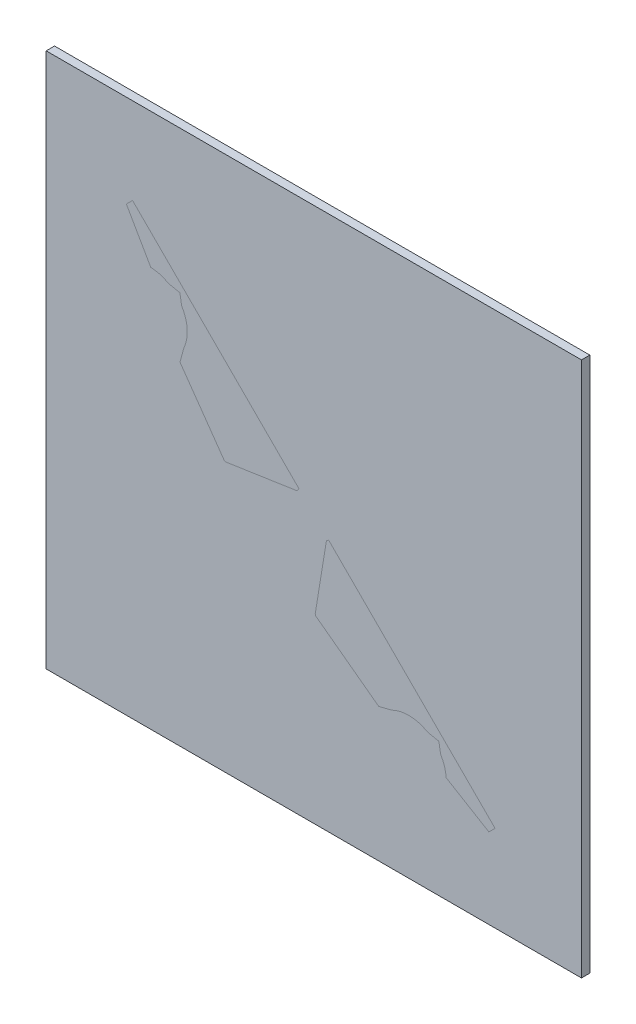
from build123d import *
from build123d.topology import SkipClean

# Parameters (mm, degrees)
BOSS_EXTRUDE1_OUTLINE_R   = 584.2
BOSS_EXTRUDE1_OUTLINE_R_2 = 2.38125
BOSS_EXTRUDE1_OUTLINE_R_3 = 85.725
BOSS_EXTRUDE1_OUTLINE_R_4 = 3.8735
BOSS_EXTRUDE1_OUTLINE_R_5 = 47.5
BOSS_EXTRUDE1_DEPTH       = 19.05
CUT_EXTRUDE1_OUTLINE_W    = 98.758926402
CUT_EXTRUDE1_OUTLINE_H    = 205.000109937
CUT_EXTRUDE1_OUTLINE_R    = 3.8735
CUT_EXTRUDE1_OUTLINE_W_2  = 41.254229691
CUT_EXTRUDE1_OUTLINE_H_2  = 54.392174278
CUT_EXTRUDE1_DEPTH        = 3.175
BOSS_EXTRUDE3_START       = 3.175
SKETCH5_R                 = 60
SKETCH5_R_2               = 47.5
BOSS_EXTRUDE3_DEPTH       = 3.175
CUT_EXTRUDE6_START        = -19.05
CUT_EXTRUDE6_OUTLINE_R    = 2.38125
CUT_EXTRUDE6_DEPTH        = 19.05
SKETCH12_W                = 1219.2
SKETCH12_H                = 1219.2
STOCK_DEPTH               = 19.05
SKETCH14_R                = 3.8735
CUT_EXTRUDE7_DEPTH        = 19.05
SKETCH16_R                = 9.652
CUT_EXTRUDE12_DEPTH       = 9.525
SKETCH17_R                = 7.1755
CUT_EXTRUDE13_DEPTH       = 6.35
SKETCH20_R                = 7.1755
CUT_EXTRUDE16_DEPTH       = 2.54


# Read off the part's stored shape, not the designer's step: Boss-Extrude1, Cut-Extrude1, Cut-Extrude6
with BuildPart() as part:
    # Boss-Extrude1 outline → Boss-Extrude1 (new body)
    with BuildSketch(Plane.XY):
        Circle(BOSS_EXTRUDE1_OUTLINE_R)
        with Locations((-282.898367517, -440.948136872)):
            Circle(BOSS_EXTRUDE1_OUTLINE_R_2, mode=Mode.SUBTRACT)
        with Locations((-148.901632483, -440.948136872)):
            Circle(BOSS_EXTRUDE1_OUTLINE_R_2, mode=Mode.SUBTRACT)
        with Locations((-66.998367517, -498.798367517)):
            Circle(BOSS_EXTRUDE1_OUTLINE_R_2, mode=Mode.SUBTRACT)
        with Locations((-215.9, -373.949769354)):
            Circle(BOSS_EXTRUDE1_OUTLINE_R_3, mode=Mode.SUBTRACT)
        with Locations((-282.898367517, -306.951401837)):
            Circle(BOSS_EXTRUDE1_OUTLINE_R_2, mode=Mode.SUBTRACT)
        with Locations((-148.901632483, -306.951401837)):
            Circle(BOSS_EXTRUDE1_OUTLINE_R_2, mode=Mode.SUBTRACT)
        with Locations((-66.998367517, -364.801632483)):
            Circle(BOSS_EXTRUDE1_OUTLINE_R_2, mode=Mode.SUBTRACT)
        with Locations((-440.948136872, -282.898367517)):
            Circle(BOSS_EXTRUDE1_OUTLINE_R_2, mode=Mode.SUBTRACT)
        with Locations((-526.121546674, -206.375)):
            Circle(BOSS_EXTRUDE1_OUTLINE_R_4, mode=Mode.SUBTRACT)
        with Locations((-533.201525575, -187.325)):
            Circle(BOSS_EXTRUDE1_OUTLINE_R_4, mode=Mode.SUBTRACT)
        with Locations((-440.948136872, -148.901632483)):
            Circle(BOSS_EXTRUDE1_OUTLINE_R_2, mode=Mode.SUBTRACT)
        with Locations((-306.951401837, -282.898367517)):
            Circle(BOSS_EXTRUDE1_OUTLINE_R_2, mode=Mode.SUBTRACT)
        with Locations((-373.949769354, -215.9)):
            Circle(BOSS_EXTRUDE1_OUTLINE_R_3, mode=Mode.SUBTRACT)
        with Locations((-306.951401837, -148.901632483)):
            Circle(BOSS_EXTRUDE1_OUTLINE_R_2, mode=Mode.SUBTRACT)
        with Locations((-565.069727445, -9.525)):
            Circle(BOSS_EXTRUDE1_OUTLINE_R_4, mode=Mode.SUBTRACT)
        with Locations((-498.798367517, -66.998367517)):
            Circle(BOSS_EXTRUDE1_OUTLINE_R_2, mode=Mode.SUBTRACT)
        with Locations((-364.801632483, -66.998367517)):
            Circle(BOSS_EXTRUDE1_OUTLINE_R_2, mode=Mode.SUBTRACT)
        with Locations((66.998367517, -498.798367517)):
            Circle(BOSS_EXTRUDE1_OUTLINE_R_2, mode=Mode.SUBTRACT)
        with Locations((148.901632483, -440.948136872)):
            Circle(BOSS_EXTRUDE1_OUTLINE_R_2, mode=Mode.SUBTRACT)
        with Locations((282.898367517, -440.948136872)):
            Circle(BOSS_EXTRUDE1_OUTLINE_R_2, mode=Mode.SUBTRACT)
        with Locations((0, -431.8)):
            Circle(BOSS_EXTRUDE1_OUTLINE_R_3, mode=Mode.SUBTRACT)
        with Locations((66.998367517, -364.801632483)):
            Circle(BOSS_EXTRUDE1_OUTLINE_R_2, mode=Mode.SUBTRACT)
        with Locations((215.9, -373.949769354)):
            Circle(BOSS_EXTRUDE1_OUTLINE_R_3, mode=Mode.SUBTRACT)
        with Locations((148.901632483, -306.951401837)):
            Circle(BOSS_EXTRUDE1_OUTLINE_R_2, mode=Mode.SUBTRACT)
        with Locations((282.898367517, -306.951401837)):
            Circle(BOSS_EXTRUDE1_OUTLINE_R_2, mode=Mode.SUBTRACT)
        with Locations((306.951401837, -282.898367517)):
            Circle(BOSS_EXTRUDE1_OUTLINE_R_2, mode=Mode.SUBTRACT)
        with Locations((306.951401837, -148.901632483)):
            Circle(BOSS_EXTRUDE1_OUTLINE_R_2, mode=Mode.SUBTRACT)
        with Locations((373.949769354, -215.9)):
            Circle(BOSS_EXTRUDE1_OUTLINE_R_3, mode=Mode.SUBTRACT)
        with Locations((440.948136872, -282.898367517)):
            Circle(BOSS_EXTRUDE1_OUTLINE_R_2, mode=Mode.SUBTRACT)
        with Locations((440.948136872, -148.901632483)):
            Circle(BOSS_EXTRUDE1_OUTLINE_R_2, mode=Mode.SUBTRACT)
        with Locations((526.121546674, -206.375)):
            Circle(BOSS_EXTRUDE1_OUTLINE_R_4, mode=Mode.SUBTRACT)
        with Locations((533.201525575, -187.325)):
            Circle(BOSS_EXTRUDE1_OUTLINE_R_4, mode=Mode.SUBTRACT)
        with Locations((364.801632483, -66.998367517)):
            Circle(BOSS_EXTRUDE1_OUTLINE_R_2, mode=Mode.SUBTRACT)
        with Locations((498.798367517, -66.998367517)):
            Circle(BOSS_EXTRUDE1_OUTLINE_R_2, mode=Mode.SUBTRACT)
        with Locations((565.069727445, -9.525)):
            Circle(BOSS_EXTRUDE1_OUTLINE_R_4, mode=Mode.SUBTRACT)
        with Locations((-565.069727445, 9.525)):
            Circle(BOSS_EXTRUDE1_OUTLINE_R_4, mode=Mode.SUBTRACT)
        with Locations((-498.798367517, 66.998367517)):
            Circle(BOSS_EXTRUDE1_OUTLINE_R_2, mode=Mode.SUBTRACT)
        with Locations((-431.8, 0)):
            Circle(BOSS_EXTRUDE1_OUTLINE_R_3, mode=Mode.SUBTRACT)
        with Locations((-364.801632483, 66.998367517)):
            Circle(BOSS_EXTRUDE1_OUTLINE_R_2, mode=Mode.SUBTRACT)
        with Locations((-533.201525575, 187.325)):
            Circle(BOSS_EXTRUDE1_OUTLINE_R_4, mode=Mode.SUBTRACT)
        with Locations((-526.121546674, 206.375)):
            Circle(BOSS_EXTRUDE1_OUTLINE_R_4, mode=Mode.SUBTRACT)
        with Locations((-440.948136872, 148.901632483)):
            Circle(BOSS_EXTRUDE1_OUTLINE_R_2, mode=Mode.SUBTRACT)
        with Locations((-440.948136872, 282.898367517)):
            Circle(BOSS_EXTRUDE1_OUTLINE_R_2, mode=Mode.SUBTRACT)
        with Locations((-373.949769354, 215.9)):
            Circle(BOSS_EXTRUDE1_OUTLINE_R_3, mode=Mode.SUBTRACT)
        with Locations((-306.951401837, 148.901632483)):
            Circle(BOSS_EXTRUDE1_OUTLINE_R_2, mode=Mode.SUBTRACT)
        with Locations((-306.951401837, 282.898367517)):
            Circle(BOSS_EXTRUDE1_OUTLINE_R_2, mode=Mode.SUBTRACT)
        with Locations((-203.2, 0)):
            Circle(BOSS_EXTRUDE1_OUTLINE_R_4, mode=Mode.SUBTRACT)
        with Locations((-282.898367517, 306.951401837)):
            Circle(BOSS_EXTRUDE1_OUTLINE_R_2, mode=Mode.SUBTRACT)
        with Locations((-148.901632483, 306.951401837)):
            Circle(BOSS_EXTRUDE1_OUTLINE_R_2, mode=Mode.SUBTRACT)
        with Locations((-215.9, 373.949769354)):
            Circle(BOSS_EXTRUDE1_OUTLINE_R_3, mode=Mode.SUBTRACT)
        with Locations((-66.998367517, 364.801632483)):
            Circle(BOSS_EXTRUDE1_OUTLINE_R_2, mode=Mode.SUBTRACT)
        with Locations((-282.898367517, 440.948136872)):
            Circle(BOSS_EXTRUDE1_OUTLINE_R_2, mode=Mode.SUBTRACT)
        with Locations((-148.901632483, 440.948136872)):
            Circle(BOSS_EXTRUDE1_OUTLINE_R_2, mode=Mode.SUBTRACT)
        with Locations((-66.998367517, 498.798367517)):
            Circle(BOSS_EXTRUDE1_OUTLINE_R_2, mode=Mode.SUBTRACT)
        Circle(BOSS_EXTRUDE1_OUTLINE_R_5, mode=Mode.SUBTRACT)
        with Locations((203.2, 0)):
            Circle(BOSS_EXTRUDE1_OUTLINE_R_4, mode=Mode.SUBTRACT)
        with Locations((364.801632483, 66.998367517)):
            Circle(BOSS_EXTRUDE1_OUTLINE_R_2, mode=Mode.SUBTRACT)
        with Locations((431.8, 0)):
            Circle(BOSS_EXTRUDE1_OUTLINE_R_3, mode=Mode.SUBTRACT)
        with Locations((498.798367517, 66.998367517)):
            Circle(BOSS_EXTRUDE1_OUTLINE_R_2, mode=Mode.SUBTRACT)
        with Locations((565.069727445, 9.525)):
            Circle(BOSS_EXTRUDE1_OUTLINE_R_4, mode=Mode.SUBTRACT)
        with Locations((306.951401837, 148.901632483)):
            Circle(BOSS_EXTRUDE1_OUTLINE_R_2, mode=Mode.SUBTRACT)
        with Locations((373.949769354, 215.9)):
            Circle(BOSS_EXTRUDE1_OUTLINE_R_3, mode=Mode.SUBTRACT)
        with Locations((306.951401837, 282.898367517)):
            Circle(BOSS_EXTRUDE1_OUTLINE_R_2, mode=Mode.SUBTRACT)
        with Locations((440.948136872, 148.901632483)):
            Circle(BOSS_EXTRUDE1_OUTLINE_R_2, mode=Mode.SUBTRACT)
        with Locations((533.201525575, 187.325)):
            Circle(BOSS_EXTRUDE1_OUTLINE_R_4, mode=Mode.SUBTRACT)
        with Locations((526.121546674, 206.375)):
            Circle(BOSS_EXTRUDE1_OUTLINE_R_4, mode=Mode.SUBTRACT)
        with Locations((440.948136872, 282.898367517)):
            Circle(BOSS_EXTRUDE1_OUTLINE_R_2, mode=Mode.SUBTRACT)
        with Locations((66.998367517, 364.801632483)):
            Circle(BOSS_EXTRUDE1_OUTLINE_R_2, mode=Mode.SUBTRACT)
        with Locations((0, 431.8)):
            Circle(BOSS_EXTRUDE1_OUTLINE_R_3, mode=Mode.SUBTRACT)
        with Locations((148.901632483, 306.951401837)):
            Circle(BOSS_EXTRUDE1_OUTLINE_R_2, mode=Mode.SUBTRACT)
        with Locations((282.898367517, 306.951401837)):
            Circle(BOSS_EXTRUDE1_OUTLINE_R_2, mode=Mode.SUBTRACT)
        with Locations((215.9, 373.949769354)):
            Circle(BOSS_EXTRUDE1_OUTLINE_R_3, mode=Mode.SUBTRACT)
        with Locations((66.998367517, 498.798367517)):
            Circle(BOSS_EXTRUDE1_OUTLINE_R_2, mode=Mode.SUBTRACT)
        with Locations((148.901632483, 440.948136872)):
            Circle(BOSS_EXTRUDE1_OUTLINE_R_2, mode=Mode.SUBTRACT)
        with Locations((282.898367517, 440.948136872)):
            Circle(BOSS_EXTRUDE1_OUTLINE_R_2, mode=Mode.SUBTRACT)
    extrude(amount=BOSS_EXTRUDE1_DEPTH)

    # Cut-Extrude1 outline → Cut-Extrude1 (cut)
    # profile 1 of 16: a face of its own
    with BuildSketch(Plane.XY):
        with Locations((202.827307192, -56.075650854)):
            Rectangle(CUT_EXTRUDE1_OUTLINE_W, CUT_EXTRUDE1_OUTLINE_H)
        with Locations((203.2, 0)):
            Circle(CUT_EXTRUDE1_OUTLINE_R, mode=Mode.SUBTRACT)
    # profile 2 of 16: a face of its own
    with BuildSketch(Plane.XY):
        with BuildLine():
            Line((37.74714416, -28.83406159), (37.74714416, -158.575705822))
            Line((37.74714416, -158.575705822), (82.350816219, -158.575705822))
            Line((82.350816219, -158.575705822), (82.350816219, 46.424404115))
            Line((82.350816219, 46.424404115), (37.74714416, 46.424404115))
            Line((37.74714416, 46.424404115), (37.74714416, 28.83406159))
            ThreePointArc((37.74714416, 28.83406159), (47.5, 0), (37.74714416, -28.83406159))
        make_face()
    # profile 3 of 16: a face of its own
    with BuildSketch(Plane.XY):
        with BuildLine():
            Line((23.362161365, -158.575705822), (23.362161365, -41.357700811))
            ThreePointArc((23.362161365, -41.357700811), (0.023623771, -47.499994125), (-23.321011924, -41.380918342))
            Line((-23.321011924, -41.380918342), (-23.346769741, -158.570572604))
            Line((-23.346769741, -158.570572604), (23.362161365, -158.575705822))
        make_face()
    # profile 4 of 16: a face of its own
    with BuildSketch(Plane.XY):
        with BuildLine():
            Line((-37.731752188, -158.567410842), (-37.703249927, -28.891433764))
            ThreePointArc((-37.703249927, -28.891433764), (-47.499998853, 0.01044031), (-37.690545841, 28.908005019))
            Line((-37.690545841, 28.908005019), (-37.686693984, 46.432694143))
            Line((-37.686693984, 46.432694143), (-82.290364966, 46.442497851))
            Line((-82.290364966, 46.442497851), (-82.33542317, -158.557607133))
            Line((-82.33542317, -158.557607133), (-37.731752188, -158.567410842))
        make_face()
    # profile 5 of 16: a face of its own
    with BuildSketch(Plane.XY):
        with BuildLine():
            ThreePointArc((10.044342028, 46.425867716), (16.894383569, 44.394028921), (23.362161365, 41.357700811))
            Line((23.362161365, 41.357700811), (23.362161365, 46.424404115))
            Line((23.362161365, 46.424404115), (10.044342028, 46.425867716))
        make_face()
    # profile 6 of 16: a face of its own
    with BuildSketch(Plane.XY):
        with BuildLine():
            Line((-23.301711537, 46.429532381), (-23.30281895, 41.391166074))
            ThreePointArc((-23.30281895, 41.391166074), (-16.85766231, 44.40798601), (-10.034137565, 46.428074301))
            Line((-10.034137565, 46.428074301), (-23.301711537, 46.429532381))
        make_face()
    # profile 7 of 16: a face of its own
    with BuildSketch(Plane.XY):
        with Locations((117.954124609, -56.075650854)):
            Rectangle(CUT_EXTRUDE1_OUTLINE_W_2, CUT_EXTRUDE1_OUTLINE_H)
    # profile 8 of 16: a face of its own
    with BuildSketch(Plane.XY):
        with Locations((202.827307192, -201.403912861)):
            Rectangle(CUT_EXTRUDE1_OUTLINE_W, CUT_EXTRUDE1_OUTLINE_H_2)
    # profile 9 of 16: a face of its own
    with BuildSketch(Plane.XY):
        Polygon((147.788771841, 61.170723971), (252.206770393, 61.170723971), (252.206770393, 137.604129426), (22.430839551, 137.604129426), align=None)
    # profile 10 of 16: a face of its own
    with BuildSketch(Plane.XY):
        Polygon((-252.191373241, -158.520273474), (-153.432449225, -158.541980291), (-153.387391021, 46.458124694), (-252.146315037, 46.479831511), align=None)
        with Locations((-203.2, 0)):
            Circle(CUT_EXTRUDE1_OUTLINE_R, mode=Mode.SUBTRACT)
    # profile 11 of 16: a face of its own
    with BuildSketch(Plane.XY):
        Polygon((-252.206764301, -228.544565961), (-153.447840285, -228.566272778), (-153.435885102, -174.174099813), (-252.194809119, -174.152392996), align=None)
    # profile 12 of 16: a face of its own
    with BuildSketch(Plane.XY):
        Polygon((-138.520786843, 46.454857074), (-138.565845047, -158.545247911), (-97.311616353, -158.554315426), (-97.266558149, 46.445789559), align=None)
    # profile 13 of 16: a face of its own
    with BuildSketch(Plane.XY):
        Polygon((-22.350348806, 137.609050789), (-252.126274098, 137.659554619), (-252.143073855, 61.22615101), (-147.725077825, 61.203200352), align=None)
    # profile 14 of 16: a face of its own
    with BuildSketch(Plane.XY):
        Polygon((-138.581236107, -228.569540398), (138.581239454, -228.6), (138.581239454, -174.207825722), (-138.569280924, -174.177367434), align=None)
    # profile 15 of 16: a face of its own
    with BuildSketch(Plane.XY):
        Polygon((120.03556483, 61.170723971), (0.040086024, 136.156625786), (-119.971871485, 61.197100308), align=None)
    # profile 16 of 16: a face of its own
    with BuildSketch(Plane.XY):
        with BuildLine():
            ThreePointArc((0.056205994, 282.837814852), (-127.339765805, 247.703277883), (-218.674381844, 152.1932929))
            Line((-218.674381844, 152.1932929), (218.758073404, 152.145219948))
            ThreePointArc((218.758073404, 152.145219948), (127.444452284, 247.675277607), (0.056205994, 282.837814852))
        make_face()
    extrude(amount=CUT_EXTRUDE1_DEPTH, mode=Mode.SUBTRACT)

    # Sketch5 → Boss-Extrude3 (add)
    with SkipClean():  # the faces are left unmerged after this step: merging them gives an invalid solid
        with BuildSketch(Plane(origin=(0, 0, 3.175), x_dir=(-1, 0, 0), z_dir=(0, 0, -1)).offset(BOSS_EXTRUDE3_START)):
            Circle(SKETCH5_R)
            Circle(SKETCH5_R_2, mode=Mode.SUBTRACT)
        extrude(amount=-BOSS_EXTRUDE3_DEPTH)

    # Cut-Extrude6 outline → Cut-Extrude6 (cut)
    with SkipClean():  # the faces are left unmerged after this step: merging them gives an invalid solid
        with BuildSketch(Plane(origin=(0, 0, 0), x_dir=(-1, 0, 0), z_dir=(0, 0, -1)).offset(CUT_EXTRUDE6_START)):
            with Locations((-54.25, 0)):
                Circle(CUT_EXTRUDE6_OUTLINE_R)
            with Locations((0, -54.25)):
                Circle(CUT_EXTRUDE6_OUTLINE_R)
            with Locations((54.25, 0)):
                Circle(CUT_EXTRUDE6_OUTLINE_R)
            with Locations((0, 54.25)):
                Circle(CUT_EXTRUDE6_OUTLINE_R)
        extrude(amount=CUT_EXTRUDE6_DEPTH, mode=Mode.SUBTRACT)

    # Sketch14 → Cut-Extrude7 (cut)
    with SkipClean():  # the faces are left unmerged after this step: merging them gives an invalid solid
        with BuildSketch(Plane(origin=(0, 0, 0), x_dir=(-1, 0, 0), z_dir=(0, 0, -1))):
            with Locations(Location((0, -196.85, 0), (0, 0, 180))):
                Circle(SKETCH14_R)
            with Locations(Location((203.2, -196.85, 0), (0, 0, 180))):
                Circle(SKETCH14_R)
            with Locations(Location((-203.2, -196.85, 0), (0, 0, 180))):
                Circle(SKETCH14_R)
            with Locations(Location((-152.4, 196.85, 0), (0, 0, 180))):
                Circle(SKETCH14_R)
            with Locations(Location((0, 196.85, 0), (0, 0, 180))):
                Circle(SKETCH14_R)
            with Locations(Location((152.4, 196.85, 0), (0, 0, 180))):
                Circle(SKETCH14_R)
        extrude(amount=-CUT_EXTRUDE7_DEPTH, mode=Mode.SUBTRACT)

    # Sketch16 → Cut-Extrude12 (cut)
    with SkipClean():  # the faces are left unmerged after this step: merging them gives an invalid solid
        with BuildSketch(Plane(origin=(0, 0, 0), x_dir=(-1, 0, 0), z_dir=(0, 0, -1))):
            with Locations(Location((0, 196.85, 0), (0, 0, 180))):
                Circle(SKETCH16_R)
            with Locations(Location((-152.4, 196.85, 0), (0, 0, 180))):
                Circle(SKETCH16_R)
            with Locations(Location((152.4, 196.85, 0), (0, 0, 180))):
                Circle(SKETCH16_R)
            with Locations(Location((203.2, 0, 0), (0, 0, 180))):
                Circle(SKETCH16_R)
            with Locations(Location((203.2, -196.85, 0), (0, 0, 180))):
                Circle(SKETCH16_R)
            with Locations(Location((0, -196.85, 0), (0, 0, 180))):
                Circle(SKETCH16_R)
            with Locations(Location((-203.2, -196.85, 0), (0, 0, 180))):
                Circle(SKETCH16_R)
            with Locations(Location((-203.2, 0, 0), (0, 0, 180))):
                Circle(SKETCH16_R)
        extrude(amount=-CUT_EXTRUDE12_DEPTH, mode=Mode.SUBTRACT)

    # Sketch17 → Cut-Extrude13 (cut)
    with SkipClean():  # the faces are left unmerged after this step: merging them gives an invalid solid
        with BuildSketch(Plane(origin=(0, 0, 0), x_dir=(-1, 0, 0), z_dir=(0, 0, -1))):
            with Locations((-526.121546674, 206.375)):
                Circle(SKETCH17_R)
            with Locations((-533.201525575, 187.325)):
                Circle(SKETCH17_R)
            with Locations((-565.069727445, 9.525)):
                Circle(SKETCH17_R)
            with Locations((-565.069727445, -9.525)):
                Circle(SKETCH17_R)
            with Locations((-533.201525575, -187.325)):
                Circle(SKETCH17_R)
            with Locations((-526.121546674, -206.375)):
                Circle(SKETCH17_R)
            with Locations(Location((526.121546674, -206.375, 0), (0, 0, 180))):
                Circle(SKETCH17_R)
            with Locations(Location((533.201525575, -187.325, 0), (0, 0, 180))):
                Circle(SKETCH17_R)
            with Locations(Location((565.069727445, -9.525, 0), (0, 0, 180))):
                Circle(SKETCH17_R)
            with Locations(Location((565.069727445, 9.525, 0), (0, 0, 180))):
                Circle(SKETCH17_R)
            with Locations(Location((533.201525575, 187.325, 0), (0, 0, 180))):
                Circle(SKETCH17_R)
            with Locations(Location((526.121546674, 206.375, 0), (0, 0, 180))):
                Circle(SKETCH17_R)
        extrude(amount=-CUT_EXTRUDE13_DEPTH, mode=Mode.SUBTRACT)

    # Sketch20 → Cut-Extrude16 (cut)
    with SkipClean():  # the faces are left unmerged after this step: merging them gives an invalid solid
        with BuildSketch(Plane(origin=(0, 0, 6.35), x_dir=(-1, 0, 0), z_dir=(0, 0, -1))):
            with Locations((-565.069727445, 9.525)):
                Circle(SKETCH20_R)
            with Locations((-565.069727445, -9.525)):
                Circle(SKETCH20_R)
            with Locations(Location((565.069727445, -9.525, 0), (0, 0, 180))):
                Circle(SKETCH20_R)
            with Locations(Location((565.069727445, 9.525, 0), (0, 0, 180))):
                Circle(SKETCH20_R)
        extrude(amount=-CUT_EXTRUDE16_DEPTH, mode=Mode.SUBTRACT)


with BuildPart() as body_2:
    # Sketch12 → Stock (new body)
    with BuildSketch(Plane(origin=(0, 0, 0), x_dir=(-1, 0, 0), z_dir=(0, 0, -1))):
        Rectangle(SKETCH12_W, SKETCH12_H)
    extrude(amount=-STOCK_DEPTH)


solid = Compound([part.part, body_2.part])
